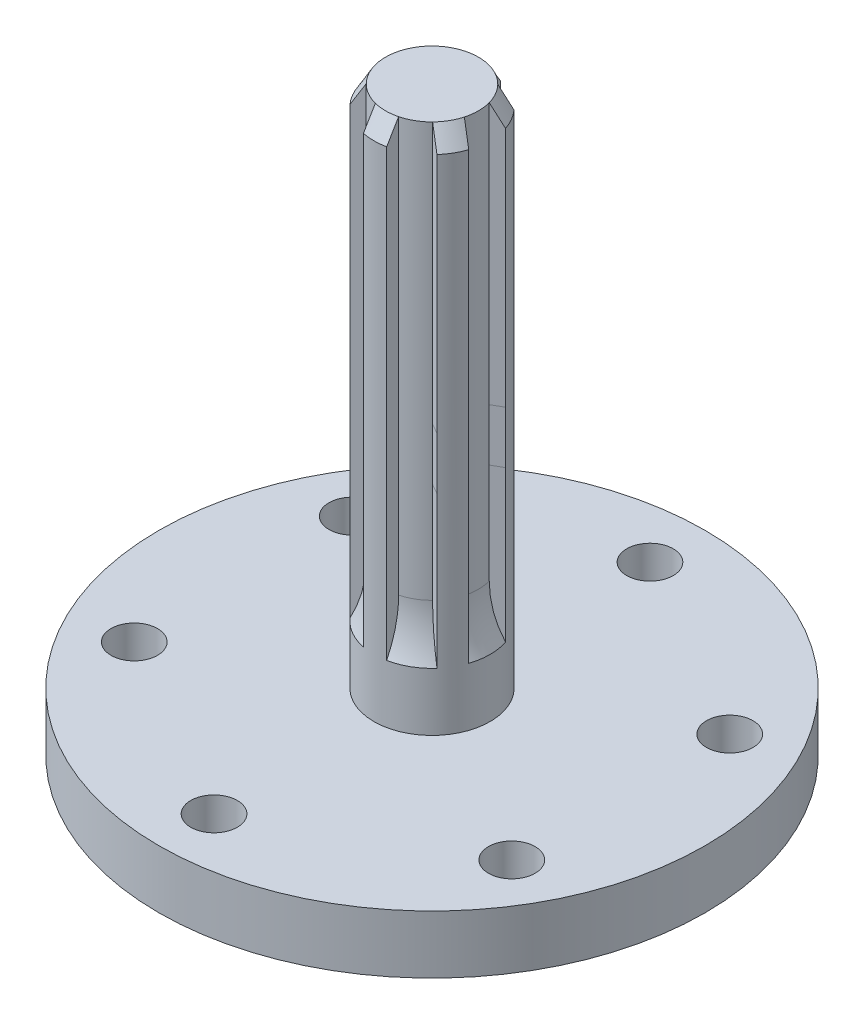
from build123d import *

# Parameters (mm, degrees)
SKETCH1_R           = 46.99
SKETCH1_R_2         = 8.509
SKETCH1_R_3         = 4
BOSS_EXTRUDE1_DEPTH = 10
BOSS_EXTRUDE2_DEPTH = 90
SKETCH4_R           = 10
BOSS_EXTRUDE3_DEPTH = 10
FILLET2_R           = 20


with BuildPart() as part:
    # Sketch1 → Boss-Extrude1 (new body)
    # profile 1 of 2: a face of its own
    with BuildSketch(Plane(origin=(0, 0, 0), x_dir=(1, 0, 0), z_dir=(0, 1, 0))):
        with Locations(Location((0, 0, 0), (0, 0, 270))):
            Circle(SKETCH1_R)
        Circle(SKETCH1_R_2, mode=Mode.SUBTRACT)
        with Locations(Location((-32.475952642, 18.75, 0), (0, 0, 270))):
            Circle(SKETCH1_R_3, mode=Mode.SUBTRACT)
        with Locations(Location((-32.475952642, -18.75, 0), (0, 0, 270))):
            Circle(SKETCH1_R_3, mode=Mode.SUBTRACT)
        with Locations(Location((0, -37.5, 0), (0, 0, 270))):
            Circle(SKETCH1_R_3, mode=Mode.SUBTRACT)
        with Locations(Location((32.475952642, -18.75, 0), (0, 0, 270))):
            Circle(SKETCH1_R_3, mode=Mode.SUBTRACT)
        with Locations(Location((32.475952642, 18.75, 0), (0, 0, 270))):
            Circle(SKETCH1_R_3, mode=Mode.SUBTRACT)
        with Locations(Location((0, 37.5, 0), (0, 0, 270))):
            Circle(SKETCH1_R_3, mode=Mode.SUBTRACT)
    # profile 2 of 2: a face of its own
    with BuildSketch(Plane(origin=(0, 0, 0), x_dir=(1, 0, 0), z_dir=(0, 1, 0))):
        Circle(SKETCH1_R_2)
    extrude(amount=BOSS_EXTRUDE1_DEPTH)

    # Sketch2 → Boss-Extrude2 (add)
    with BuildSketch(Plane(origin=(0, 10, 0), x_dir=(1, 0, 0), z_dir=(0, 1, 0))):
        with BuildLine():
            Line((-5.708203932, 5.605034154), (-7.485281374, 6.631030293))
            ThreePointArc((-7.485281374, 6.631030293), (-8.660254038, 5), (-9.485281374, 3.166928678))
            Line((-9.485281374, 3.166928678), (-7.708203932, 2.140932539))
            ThreePointArc((-7.708203932, 2.140932539), (-8, 0), (-7.708203932, -2.140932539))
            Line((-7.708203932, -2.140932539), (-9.485281374, -3.166928678))
            ThreePointArc((-9.485281374, -3.166928678), (-8.660254038, -5), (-7.485281374, -6.631030293))
            Line((-7.485281374, -6.631030293), (-5.708203932, -5.605034154))
            ThreePointArc((-5.708203932, -5.605034154), (-4, -6.92820323), (-2, -7.745966692))
            Line((-2, -7.745966692), (-2, -9.797958971))
            ThreePointArc((-2, -9.797958971), (0, -10), (2, -9.797958971))
            Line((2, -9.797958971), (2, -7.745966692))
            ThreePointArc((2, -7.745966692), (4, -6.92820323), (5.708203932, -5.605034154))
            Line((5.708203932, -5.605034154), (7.485281374, -6.631030293))
            ThreePointArc((7.485281374, -6.631030293), (8.660254038, -5), (9.485281374, -3.166928678))
            Line((9.485281374, -3.166928678), (7.708203932, -2.140932539))
            ThreePointArc((7.708203932, -2.140932539), (8, 0), (7.708203932, 2.140932539))
            Line((7.708203932, 2.140932539), (9.485281374, 3.166928678))
            ThreePointArc((9.485281374, 3.166928678), (8.660254038, 5), (7.485281374, 6.631030293))
            Line((7.485281374, 6.631030293), (5.708203932, 5.605034154))
            ThreePointArc((5.708203932, 5.605034154), (4, 6.92820323), (2, 7.745966692))
            Line((2, 7.745966692), (2, 9.797958971))
            ThreePointArc((2, 9.797958971), (0, 10), (-2, 9.797958971))
            Line((-2, 9.797958971), (-2, 7.745966692))
            ThreePointArc((-2, 7.745966692), (-4, 6.92820323), (-5.708203932, 5.605034154))
        make_face()
    extrude(amount=BOSS_EXTRUDE2_DEPTH)

    # Sketch4 → Boss-Extrude3 (add)
    with BuildSketch(Plane(origin=(0, 10, 0), x_dir=(1, 0, 0), z_dir=(0, 1, 0))):
        with Locations(Location((0, 0, 0), (0, 0, 101.536959033))):
            Circle(SKETCH4_R)
    extrude(amount=BOSS_EXTRUDE3_DEPTH)

    # Fillet2
    # the kernel refuses this fillet: 20 mm, written as the material it adds along each edge
    with BuildSketch(Plane(origin=(0, 20, 0), x_dir=(0.9893271243483546, 0, 0.1457114993012412), z_dir=(0.1457114993012412, 0, -0.9893271243483546))) as fillet2_piece_1:
        with BuildLine():
            CenterArc((28, -8.717797887), FILLET2_R, 154.158067237, 25.841932763)
            Line((8, -8.717797887), (8, 0))
            Line((8, 0), (10, 0))
        make_face()
    revolve(axis=Axis((0, 20, 0), (0, -1, 0)), revolution_arc=343.243034599)
    with BuildSketch(Plane(origin=(0, 20, 0), x_dir=(0.6208534221926202, 0, -0.7839266726880214), z_dir=(-0.7839266726880214, 0, -0.6208534221926202))) as fillet2_piece_2:
        with BuildLine():
            CenterArc((28, -8.717797887), FILLET2_R, 154.158067237, 25.841932763)
            Line((8, -8.717797887), (8, 0))
            Line((8, 0), (10, 0))
        make_face()
    revolve(axis=Axis((0, 20, 0), (0, -1, 0)), revolution_arc=343.243034599)
    with BuildSketch(Plane(origin=(0, 20, 0), x_dir=(-0.36847370215574865, 0, -0.9296381719893158), z_dir=(-0.9296381719893158, 0, 0.36847370215574865))) as fillet2_piece_3:
        with BuildLine():
            CenterArc((28, -8.717797887), FILLET2_R, 154.158067237, 25.841932763)
            Line((10, 0), (8, 0))
            Line((8, 0), (8, -8.717797887))
        make_face()
    revolve(axis=Axis((0, 20, 0), (0, -1, 0)), revolution_arc=343.243034599)
    with BuildSketch(Plane(origin=(0, 20, 0), x_dir=(-0.9893271243483555, 0, -0.14571149930123434), z_dir=(-0.14571149930123434, 0, 0.9893271243483555))) as fillet2_piece_4:
        with BuildLine():
            CenterArc((28, -8.717797887), FILLET2_R, 154.158067237, 25.841932763)
            Line((10, 0), (8, 0))
            Line((8, 0), (8, -8.717797887))
        make_face()
    revolve(axis=Axis((0, 20, 0), (0, -1, 0)), revolution_arc=343.243034599)
    with BuildSketch(Plane(origin=(0, 20, 0), x_dir=(-0.6208534221925923, 0, 0.7839266726880435), z_dir=(0.7839266726880435, 0, 0.6208534221925923))) as fillet2_piece_5:
        with BuildLine():
            CenterArc((28, -8.717797887), FILLET2_R, 154.158067237, 25.841932763)
            Line((8, -8.717797887), (8, 0))
            Line((8, 0), (10, 0))
        make_face()
    revolve(axis=Axis((0, 20, 0), (0, -1, 0)), revolution_arc=343.243034599)
    with BuildSketch(Plane(origin=(0, 20, 0), x_dir=(0.3684737021557518, 0, 0.9296381719893145), z_dir=(0.9296381719893145, 0, -0.3684737021557518))) as fillet2_piece_6:
        with BuildLine():
            CenterArc((28, -8.717797887), FILLET2_R, 154.158067237, 25.841932763)
            Line((8, -8.717797887), (8, 0))
            Line((8, 0), (10, 0))
        make_face()
    revolve(axis=Axis((0, 20, 0), (0, -1, 0)), revolution_arc=343.243034599)

    # Sketch7 → Cut-Revolve1 (revolve, cut)
    with BuildSketch(Plane(origin=(0, 0, 0), x_dir=(0, 0, -1), z_dir=(1, 0, 0)), mode=Mode.PRIVATE) as cut_revolve1_sk:
        Polygon((10, 100), (10, 96.535898385), (8, 100), align=None)
    revolve(cut_revolve1_sk.sketch.rotate(Axis((0, 136.433969782, 0), (0, -1, 0)), 348.463040967), axis=Axis((0, 136.433969782, 0), (0, -1, 0)), mode=Mode.SUBTRACT)


solid = part.part
